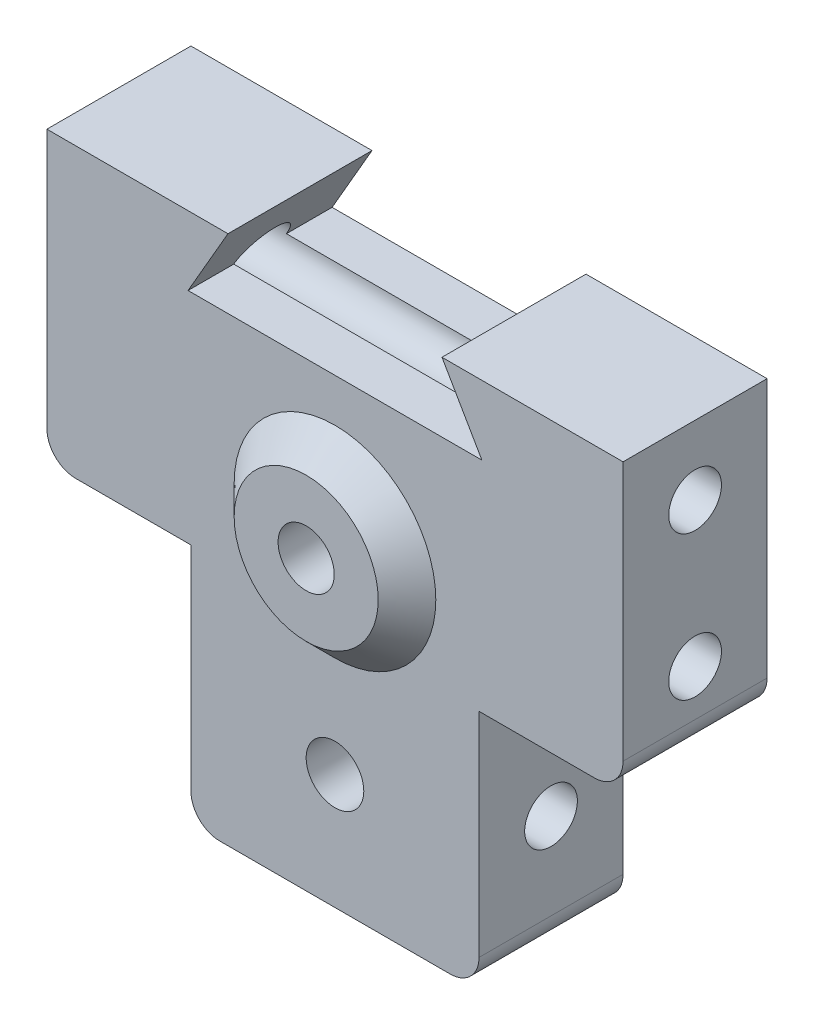
from build123d import *

# Parameters (mm, degrees)
SKETCH1_W           = 20
SKETCH1_H           = 5
BOSS_EXTRUDE1_DEPTH = 10
CUT_EXTRUDE1_DEPTH  = 16
SKETCH8_R           = 0.915
CUT_EXTRUDE6_DEPTH  = 23.5
SKETCH7_R           = 0.915
CUT_EXTRUDE5_DEPTH  = 23.5
SKETCH10_R          = 2.5
BOSS_EXTRUDE4_DEPTH = 1
SKETCH5_W           = 10
SKETCH5_H           = 8.4
BOSS_EXTRUDE3_DEPTH = 5
SKETCH6_R           = 1
CUT_EXTRUDE4_DEPTH  = 16
CUT_EXTRUDE7_REACH  = 20.364
SKETCH9_R           = 0.915
SKETCH11_R          = 0.975
CUT_EXTRUDE8_DEPTH  = 16.362291535
CHAMFER1_SIZE       = 1
FILLET1_R           = 1


with BuildPart() as part:
    # Sketch1 → Boss-Extrude1 (new body)
    with BuildSketch(Plane(origin=(0, 0, 0), x_dir=(1, 0, 0), z_dir=(0, 1, 0))):
        Rectangle(SKETCH1_W, SKETCH1_H)
    extrude(amount=BOSS_EXTRUDE1_DEPTH)

    # Sketch2 → Cut-Extrude1 (cut, through all)
    with BuildSketch(Plane.XY.offset(2.5)):
        Polygon((3.714359354, 10), (-3.714359354, 10), (-5.1, 7.6), (5.1, 7.6), align=None)
    extrude(amount=-CUT_EXTRUDE1_DEPTH, mode=Mode.SUBTRACT)

    # Sketch8 → Cut-Extrude6 (cut, through all)
    with BuildSketch(Plane(origin=(10, 0, 0), x_dir=(0, 0, -1), z_dir=(1, 0, 0))):
        with Locations((0, 7.6)):
            Circle(SKETCH8_R)
    extrude(amount=-CUT_EXTRUDE6_DEPTH, mode=Mode.SUBTRACT)

    # Sketch7 → Cut-Extrude5 (cut, through all)
    with BuildSketch(Plane(origin=(10, 0, 0), x_dir=(0, 0, -1), z_dir=(1, 0, 0))):
        with Locations((0, 2.6)):
            Circle(SKETCH7_R)
    extrude(amount=-CUT_EXTRUDE5_DEPTH, mode=Mode.SUBTRACT)

    # Sketch10 → Boss-Extrude4 (add)
    with BuildSketch(Plane.XY.offset(2.5)):
        with Locations(Location((0, 2.6, 0), (0, 0, 180))):
            Circle(SKETCH10_R)
    extrude(amount=BOSS_EXTRUDE4_DEPTH)

    # Sketch5 → Boss-Extrude3 (add)
    with BuildSketch(Plane(origin=(0, 0, -2.5), x_dir=(-1, 0, 0), z_dir=(0, 0, -1))):
        with Locations((0, -4.2)):
            Rectangle(SKETCH5_W, SKETCH5_H)
    extrude(amount=-BOSS_EXTRUDE3_DEPTH)

    # Sketch6 → Cut-Extrude4 (cut, through all)
    with BuildSketch(Plane.XY.offset(2.5)):
        with Locations((0, -4.4)):
            Circle(SKETCH6_R)
    extrude(amount=-CUT_EXTRUDE4_DEPTH, mode=Mode.SUBTRACT)

    # Cut-Extrude7: up to this face of the body (flat: up to its plane)
    cut_extrude7_end = Plane(part.part.faces().sort_by_distance((-5, -4.2, 0))[0])
    # Sketch9 → Cut-Extrude7 (cut, up to the picked face)
    with BuildSketch(Plane(origin=(5, 0, 0), x_dir=(0, 0, -1), z_dir=(1, 0, 0)), mode=Mode.PRIVATE) as cut_extrude7_sk1:
        with Locations((0, -4.4)):
            Circle(SKETCH9_R)
    cut_extrude7_tool1 = split(extrude(cut_extrude7_sk1.sketch, amount=-CUT_EXTRUDE7_REACH, mode=Mode.PRIVATE), bisect_by=cut_extrude7_end, keep=Keep.BOTH, mode=Mode.PRIVATE)
    add(cut_extrude7_tool1.solids().sort_by(Axis((5, -4.4, 0), (-1, 0, 0)))[0], mode=Mode.SUBTRACT)

    # Sketch11 → Cut-Extrude8 (cut, through all)
    with BuildSketch(Plane.XY.offset(3.5)):
        with Locations((0, 2.6)):
            Circle(SKETCH11_R)
    extrude(amount=-CUT_EXTRUDE8_DEPTH, mode=Mode.SUBTRACT)

    # Chamfer1
    chamfer1_edges = [part.edges().sort_by_distance(p)[0] for p in [
        (2.5, 2.6, 2.5),
    ]]
    chamfer(chamfer1_edges, length=CHAMFER1_SIZE - 0.0001)  # a hair under: the kernel refuses the full size

    # Fillet1
    fillet1_edges = [part.edges().sort_by_distance(p)[0] for p in [
        (-10, 0, 0),
        (-5, -8.4, 0),
        (5, -8.4, 0),
        (10, 0, 0),
    ]]
    fillet(fillet1_edges, radius=FILLET1_R)


solid = part.part
